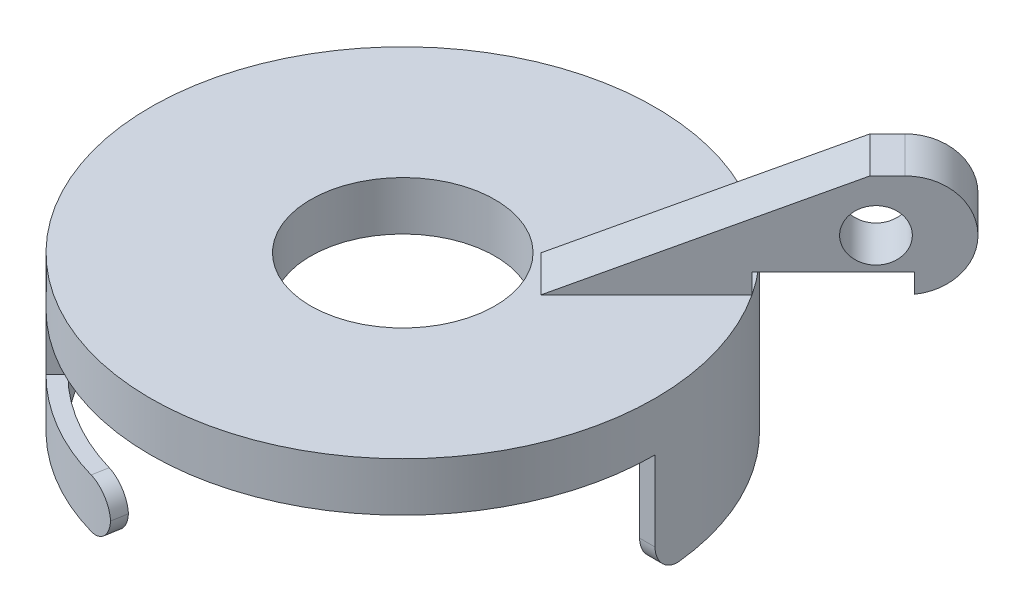
from build123d import *
from build123d.topology import SkipClean

# Parameters (mm, degrees)
SKETCH_1_R          = 24.5
EXTRUDE_1_DEPTH     = 4.75
EXTRUDE_START       = 5.5
EXTRUDE_2_DEPTH     = 5.5
EXTRUDE_START_2     = 4.75
EXTRUDE_3_DEPTH     = 4.75
SKETCH_6_R          = 8.95
CUT_EXTRUDE_1_DEPTH = 38.755794257
SKETCH_8_W          = 30
SKETCH_8_H          = 10
EXTRUDE_4_DEPTH     = 5
FILLET_1_R          = 10
FILLET_2_R          = 5
MM_1_D              = 5
SKETCH_11_W         = 11.168523271
SKETCH_11_H         = 1.926491066
CUT_EXTRUDE_2_DEPTH = 45.650628903
CUT_EXTRUDE_3_DEPTH = 45.584890939
FILLET_3_R          = 2.5


# Some blends are built 0.0001 mm under size
with BuildPart() as part:
    # 草图1 → 凸台-拉伸1 (new body)
    with BuildSketch(Plane(origin=(0, 0, 0), x_dir=(1, 0, 0), z_dir=(0, 1, 0))):
        with Locations(Location((0, 0, 0), (0, 0, 270))):
            Circle(SKETCH_1_R)
    extrude(amount=EXTRUDE_1_DEPTH)

    # 草图4 → 凸台-拉伸2 (add)
    with BuildSketch(Plane.XZ.offset(EXTRUDE_START)):
        with BuildLine():
            Line((-23, 0), (-24.5, 0))
            ThreePointArc((-24.5, 0), (-22.635048547, 9.375744093), (-17.324116139, 17.324116139))
            Line((-17.324116139, 17.324116139), (-16.263455967, 16.263455967))
            ThreePointArc((-16.263455967, 16.263455967), (-21.249229248, 8.801718944), (-23, 0))
        make_face()
        with BuildLine():
            Line((23, 0), (24.5, 0))
            ThreePointArc((24.5, 0), (22.635048547, -9.375744093), (17.324116139, -17.324116139))
            Line((17.324116139, -17.324116139), (16.263455967, -16.263455967))
            ThreePointArc((16.263455967, -16.263455967), (21.249229248, -8.801718944), (23, 0))
        make_face()
    extrude(amount=-EXTRUDE_2_DEPTH)

    # 草图5 → 凸台-拉伸3 (add)
    with SkipClean():  # the faces are left unmerged after this step: merging them gives an invalid solid
        with BuildSketch(Plane.XZ.offset(5.5).offset(EXTRUDE_START_2)):
            with BuildLine():
                Line((-23, 0), (-24.5, 0))
                ThreePointArc((-24.5, 0), (-18.768088856, 15.748296437), (-4.254380353, 24.127789949))
                Line((-4.254380353, 24.127789949), (-3.993908086, 22.650578319))
                ThreePointArc((-3.993908086, 22.650578319), (-17.619022192, 14.784115023), (-23, 0))
            make_face()
            with BuildLine():
                Line((3.993908086, -22.650578319), (4.254380353, -24.127789949))
                ThreePointArc((4.254380353, -24.127789949), (18.768088856, -15.748296437), (24.5, 0))
                Line((24.5, 0), (23, 0))
                ThreePointArc((23, 0), (17.619022192, -14.784115023), (3.993908086, -22.650578319))
            make_face()
        extrude(amount=-EXTRUDE_3_DEPTH)

    # 草图6 → 切除-拉伸1 (cut, through all)
    with SkipClean():  # the faces are left unmerged after this step: merging them gives an invalid solid
        with BuildSketch(Plane(origin=(0, 4.75, 0), x_dir=(1, 0, 0), z_dir=(0, 1, 0))):
            with Locations(Location((0, 0, 0), (0, 0, 270))):
                Circle(SKETCH_6_R)
        extrude(amount=-CUT_EXTRUDE_1_DEPTH, mode=Mode.SUBTRACT)

    # 草图8 → 凸台-拉伸4 (add)
    with SkipClean():  # the faces are left unmerged after this step: merging them gives an invalid solid
        with BuildSketch(Plane(origin=(0, 0, 0), x_dir=(0.7071067811865489, 0, -0.7071067811865462), z_dir=(0.7071067811865462, 0, 0.7071067811865489))):
            with Locations((24.5, 9.75)):
                Rectangle(SKETCH_8_W, SKETCH_8_H)
        extrude(amount=EXTRUDE_4_DEPTH)

    # 圆角1
    fillet_1_edges = [part.edges().sort_by_distance(p)[0] for p in [
        (8.485281374, 14.75, -4.949747468),
    ]]
    fillet(fillet_1_edges, radius=FILLET_1_R - 0.0001)  # a hair under: the kernel refuses the full size

    # 圆角2
    fillet_2_edges = [part.edges().sort_by_distance(p)[0] for p in [
        (29.69848481, 14.75, -26.162950904),
        (29.69848481, 4.75, -26.162950904),
    ]]
    fillet(fillet_2_edges, radius=FILLET_2_R - 0.0001)  # a hair under: the kernel refuses the full size

    # 大小mm 暗销孔1 (through all)
    with Locations(Plane(origin=(3.535533906, 0, 3.535533906), x_dir=(0.7071067811865488, 0, -0.7071067811865462), z_dir=(0.7071067811865462, 0, 0.7071067811865488))):
        with Locations((32.49436991, 9.75)):
            Hole(MM_1_D / 2)

    # 草图11 → 切除-拉伸2 (cut, through all)
    with BuildSketch(Plane(origin=(3.535533906, 0, 3.535533906), x_dir=(0.7071067811865489, 0, -0.7071067811865461), z_dir=(0.7071067811865461, 0, 0.7071067811865489))):
        with Locations((29.568631546, 5.713245533)):
            Rectangle(SKETCH_11_W, SKETCH_11_H)
    extrude(amount=-CUT_EXTRUDE_2_DEPTH, mode=Mode.SUBTRACT)

    # 草图12 → 切除-拉伸3 (cut, through all)
    with BuildSketch(Plane(origin=(0, 0, 0), x_dir=(-0.7071067811865489, 0, 0.7071067811865461), z_dir=(-0.7071067811865461, 0, -0.7071067811865489))):
        with BuildLine():
            Line((-32.081510731, 14.75), (-9.5, 4.75))
            ThreePointArc((-9.5, 4.75), (-12.428932188, 11.821067812), (-19.5, 14.75))
            Line((-19.5, 14.75), (-32.081510731, 14.75))
        make_face()
    extrude(amount=-CUT_EXTRUDE_3_DEPTH, mode=Mode.SUBTRACT)


with BuildPart() as cut_extrude_3_kept_piece:
    # of the separate pieces the step leaves, the one the design keeps (cut_extrude_3_pieces_kept)
    add(part.part.solids().sort_by_distance((24.395254662, 14.75, -24.395254662))[0])

    # 圆角3
    # the kernel refuses this fillet: 2.5 mm, written as the material it takes off along each edge
    with BuildSketch(Plane(origin=(-16.75, -10.25, 0), x_dir=(0, 1, 0), z_dir=(-1, 0, 0)), Plane(origin=(2.908606976, -10.25, -16.495529863), x_dir=(0.9848077530122085, 0, 0.17364817766692725), z_dir=(0.17364817766692725, 0, -0.9848077530122086)), Plane(origin=(30.75, -10.25, 0), x_dir=(0, 0, -1), z_dir=(-1, 0, 0))) as fillet_3_piece_1:
        with BuildLine():
            CenterArc((FILLET_3_R, -FILLET_3_R), FILLET_3_R, 90, 90)
            Line((0, -FILLET_3_R), (0, 0))
            Line((0, 0), (FILLET_3_R, 0))
        make_face()
    extrude(amount=14, mode=Mode.SUBTRACT)
    with BuildSketch(Plane(origin=(2.908606976, -5.5, -16.495529863), x_dir=(0.9848077530122085, 0, 0.17364817766692725), z_dir=(0.17364817766692725, 0, -0.9848077530122086)), Plane(origin=(-5.339681463, -5.5, 30.282838405), x_dir=(0, -1, 0), z_dir=(0.17364817766692875, 0, -0.9848077530122084)), Plane(origin=(-5.339681463, -10.25, 30.282838405), x_dir=(-0.9848077530122084, 0, -0.17364817766692872), z_dir=(0.17364817766692875, 0, -0.9848077530122084))) as fillet_3_piece_2:
        with BuildLine():
            CenterArc((FILLET_3_R, FILLET_3_R), FILLET_3_R, 180, 90)
            Line((0, FILLET_3_R), (0, 0))
            Line((0, 0), (FILLET_3_R, 0))
        make_face()
    extrude(amount=14, mode=Mode.SUBTRACT)


solid = cut_extrude_3_kept_piece.part
